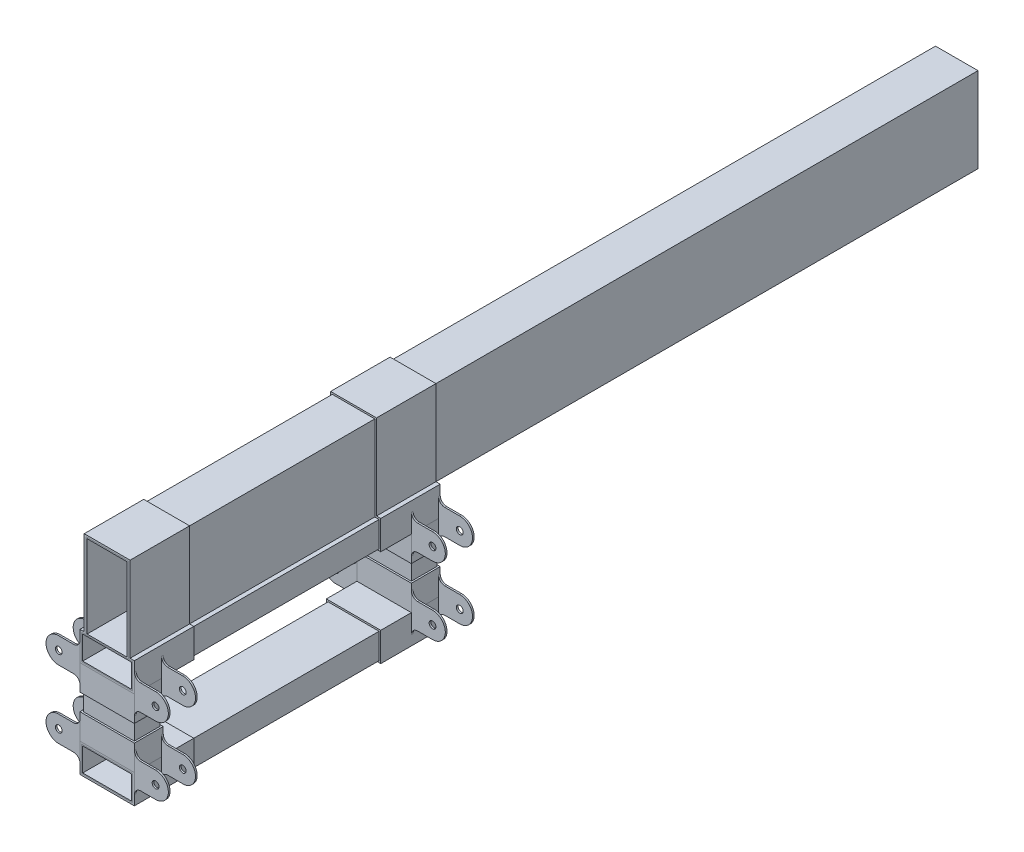
from build123d import *

# Parameters (mm, degrees)
CROQUIS1_W               = 50
CROQUIS1_H               = 100
CROQUIS1_W_2             = 47.2
CROQUIS1_H_2             = 97.2
SALIENTE_EXTRUIR1_DEPTH  = 500
CROQUIS2_W               = 60
CROQUIS2_H               = 360
SALIENTE_EXTRUIR2_DEPTH  = 30
CROQUIS3_W               = 57.6
CROQUIS3_H               = 27.6
CORTAR_EXTRUIR1_DEPTH    = 360
SALIENTE_EXTRUIR3_DEPTH  = 70
CROQUIS7_W               = 60
CROQUIS7_H               = 30
CROQUIS7_W_2             = 57.6
CROQUIS7_H_2             = 27.6
SALIENTE_EXTRUIR5_DEPTH  = 80
CROQUIS8_W               = 64
CROQUIS8_H               = 34
CROQUIS8_W_2             = 60
CROQUIS8_H_2             = 30
SALIENTE_EXTRUIR6_DEPTH  = 30
CROQUIS9_W               = 60
CROQUIS9_H               = 30
CROQUIS9_W_2             = 57.6
CROQUIS9_H_2             = 27.6
SALIENTE_EXTRUIR7_DEPTH  = 360
CROQUIS10_W              = 64
CROQUIS10_H              = 34
CROQUIS10_W_2            = 60
CROQUIS10_H_2            = 30
SALIENTE_EXTRUIR8_DEPTH  = 70
CROQUIS11_R              = 4
SALIENTE_EXTRUIR9_DEPTH  = 2
SALIENTE_EXTRUIR10_DEPTH = 2
CROQUIS13_R              = 4
SALIENTE_EXTRUIR11_DEPTH = 2
SALIENTE_EXTRUIR12_DEPTH = 2


with BuildPart() as part:
    # Croquis1 → Saliente-Extruir1 (new, symmetric)
    with BuildSketch(Plane.XY):
        Rectangle(CROQUIS1_W, CROQUIS1_H)
        Rectangle(CROQUIS1_W_2, CROQUIS1_H_2, mode=Mode.SUBTRACT)
    extrude(amount=SALIENTE_EXTRUIR1_DEPTH, both=True)


with BuildPart() as body_2:
    # Croquis2 → Saliente-Extruir2 (new body)
    with BuildSketch(Plane.XZ.offset(50)):
        with Locations((0, 320)):
            Rectangle(CROQUIS2_W, CROQUIS2_H)
    extrude(amount=SALIENTE_EXTRUIR2_DEPTH)

    # Croquis3 → Cortar-Extruir1 (cut)
    with BuildSketch(Plane.XY.offset(500)):
        with Locations((0, -65)):
            Rectangle(CROQUIS3_W, CROQUIS3_H)
    extrude(amount=-CORTAR_EXTRUIR1_DEPTH, mode=Mode.SUBTRACT)


with BuildPart() as body_3:
    # Croquis4 → Saliente-Extruir3 (new body)
    with BuildSketch(Plane.XY.offset(500)):
        Polygon((27, 52), (-27, 52), (-27, -48), (-32, -48), (-32, -82), (32, -82), (32, -48), (27, -48), align=None)
        Polygon((30, -80), (-30, -80), (-30, -50), (-25, -50), (-25, 50), (25, 50), (25, -50), (30, -50), align=None, mode=Mode.SUBTRACT)
    extrude(amount=-SALIENTE_EXTRUIR3_DEPTH)


with BuildPart() as body_4:
    # Sólido-Mover/Copiar1: copy of body 3
    add(body_3.part.moved(Location((0, 0, -300))))


with BuildPart() as body_4_1:
    # Sólido-Mover/Copiar2: read off the stored shape, not the designer's step
    # Sólido-Mover/Copiar2: moved
    add(body_4.part.moved(Location((0, 0, 10))))


with BuildPart() as body_5:
    # Croquis7 → Saliente-Extruir5 (new body)
    with BuildSketch(Plane.XZ.offset(82)):
        with Locations((0, 483)):
            Rectangle(CROQUIS7_W, CROQUIS7_H)
        with Locations((0, 483)):
            Rectangle(CROQUIS7_W_2, CROQUIS7_H_2, mode=Mode.SUBTRACT)
    extrude(amount=SALIENTE_EXTRUIR5_DEPTH)


with BuildPart() as body_6:
    # Croquis8 → Saliente-Extruir6 (new body)
    with BuildSketch(Plane.XZ.offset(82)):
        with Locations((0, 483)):
            Rectangle(CROQUIS8_W, CROQUIS8_H)
        with Locations((0, 483)):
            Rectangle(CROQUIS8_W_2, CROQUIS8_H_2, mode=Mode.SUBTRACT)
    extrude(amount=SALIENTE_EXTRUIR6_DEPTH)


with BuildPart() as body_7:
    # Sólido-Mover/Copiar4: read off the stored shape, not the designer's step
    # Sólido-Mover/Copiar4: copy of body 5
    add(body_5.part.moved(Location((0, 0, -326))))


with BuildPart() as body_8:
    # S_lido-Mover_Copiar4 2: copy of body 6
    add(body_6.part.moved(Location((0, 0, -326))))


with BuildPart() as body_9:
    # Sólido-Mover/Copiar6: read off the stored shape, not the designer's step
    # Sólido-Mover/Copiar6: copy of body 8
    add(body_8.part.moved(Location((0, -50, 0))))


with BuildPart() as body_10:
    # S_lido-Mover_Copiar6 2: copy of body 8
    add(body_8.part.moved(Location((0, -50, 326))))


with BuildPart() as body_11:
    # Croquis9 → Saliente-Extruir7 (new body)
    with BuildSketch(Plane.XY.offset(500)):
        with Locations((0, -179)):
            Rectangle(CROQUIS9_W, CROQUIS9_H)
        with Locations((0, -179)):
            Rectangle(CROQUIS9_W_2, CROQUIS9_H_2, mode=Mode.SUBTRACT)
    extrude(amount=-SALIENTE_EXTRUIR7_DEPTH)


with BuildPart() as body_12:
    # Croquis10 → Saliente-Extruir8 (new body)
    with BuildSketch(Plane.XY.offset(500)):
        with Locations((0, -179)):
            Rectangle(CROQUIS10_W, CROQUIS10_H)
        with Locations((0, -179)):
            Rectangle(CROQUIS10_W_2, CROQUIS10_H_2, mode=Mode.SUBTRACT)
    extrude(amount=-SALIENTE_EXTRUIR8_DEPTH)


with BuildPart() as body_13:
    # Sólido-Mover/Copiar8: copy of body 12
    add(body_12.part.moved(Location((0, 0, -290))))


with BuildPart() as body_14:
    # Croquis11 → Saliente-Extruir9 (new body)
    with BuildSketch(Plane.XY.offset(500)):
        with BuildLine():
            Line((32, -67), (57, -67))
            ThreePointArc((57, -67), (72, -82), (57, -97))
            Line((57, -97), (32, -97))
            Line((32, -97), (32, -67))
        make_face()
        with Locations((57, -82)):
            Circle(CROQUIS11_R, mode=Mode.SUBTRACT)
    extrude(amount=-SALIENTE_EXTRUIR9_DEPTH)

    # Croquis12 → Saliente-Extruir10 (add)
    with BuildSketch(Plane.XY.offset(500)):
        with BuildLine():
            Line((39.5, -67), (32, -67))
            Line((32, -67), (32, -59.5))
            ThreePointArc((32, -59.5), (34.196699141, -64.803300859), (39.5, -67))
        make_face()
        with BuildLine():
            Line((39.5, -97), (32, -97))
            Line((32, -97), (32, -104.5))
            ThreePointArc((32, -104.5), (34.196699141, -99.196699141), (39.5, -97))
        make_face()
    extrude(amount=-SALIENTE_EXTRUIR10_DEPTH)


with BuildPart() as body_15:
    # Sólido-Mover/Copiar10: copy of body 14
    add(body_14.part.moved(Location((0, 0, -22.134687648))))


with BuildPart() as body_15_1:
    # Sólido-Mover/Copiar11: read off the stored shape, not the designer's step
    # Sólido-Mover/Copiar11: moved
    add(body_15.part.moved(Location((0, 0, -9.8653124))))


with BuildPart() as body_16:
    # Sólido-Mover/Copiar12: read off the stored shape, not the designer's step
    # Sólido-Mover/Copiar12: copy of body 15
    add(body_15_1.part.moved(Location((0, 0, -313.3183842))))


with BuildPart() as body_17:
    # S_lido-Mover_Copiar12 2: copy of body 15
    add(body_15_1.part.moved(Location((0, 0, -281.3183842))))


with BuildPart() as body_16_1:
    # Sólido-Mover/Copiar13: read off the stored shape, not the designer's step
    # Sólido-Mover/Copiar13: moved
    add(body_16.part.moved(Location((0, 0, -12.6816158))))


with BuildPart() as body_17_1:
    # S_lido-Mover_Copiar13 2: moved
    add(body_17.part.moved(Location((0, 0, -12.6816158))))


with BuildPart() as body_18:
    # Croquis13 → Saliente-Extruir11 (new body)
    with BuildSketch(Plane.XY.offset(500)):
        with BuildLine():
            Line((32, -147), (57, -147))
            ThreePointArc((57, -147), (72, -162), (57, -177))
            Line((57, -177), (32, -177))
            Line((32, -177), (32, -147))
        make_face()
        with Locations((57, -162)):
            Circle(CROQUIS13_R, mode=Mode.SUBTRACT)
    extrude(amount=-SALIENTE_EXTRUIR11_DEPTH)

    # Croquis14 → Saliente-Extruir12 (add)
    with BuildSketch(Plane.XY.offset(500)):
        with BuildLine():
            Line((39.5, -147), (32, -147))
            Line((32, -147), (32, -139.5))
            ThreePointArc((32, -139.5), (34.196699141, -144.803300859), (39.5, -147))
        make_face()
        with BuildLine():
            Line((39.5, -177), (32, -177))
            Line((32, -177), (32, -184.5))
            ThreePointArc((32, -184.5), (34.196699141, -179.196699141), (39.5, -177))
        make_face()
    extrude(amount=-SALIENTE_EXTRUIR12_DEPTH)


with BuildPart() as body_19:
    # Sólido-Mover/Copiar14: copy of body 18
    add(body_18.part.moved(Location((0, 0, -30.003908029))))


with BuildPart() as body_19_1:
    # Sólido-Mover/Copiar15: read off the stored shape, not the designer's step
    # Sólido-Mover/Copiar15: moved
    add(body_19.part.moved(Location((0, 0, -1.996092))))


with BuildPart() as body_20:
    # Sólido-Mover/Copiar17: read off the stored shape, not the designer's step
    # Sólido-Mover/Copiar17: copy of body 19
    add(body_19_1.part.moved(Location((0, 0, -308.9967166))))


with BuildPart() as body_21:
    # S_lido-Mover_Copiar17 2: copy of body 19
    add(body_19_1.part.moved(Location((0, 0, -276.9967166))))


with BuildPart() as body_20_1:
    # Sólido-Mover/Copiar18: read off the stored shape, not the designer's step
    # Sólido-Mover/Copiar18: moved
    add(body_20.part.moved(Location((0, 0, -17.0032834))))


with BuildPart() as body_21_1:
    # S_lido-Mover_Copiar18 2: moved
    add(body_21.part.moved(Location((0, 0, -17.0032834))))


with BuildPart() as body_22:
    # Simetría1: mirrored copy
    add(body_20_1.part.mirror(Plane(origin=(0, 0, 0), x_dir=(0, 0, 1), z_dir=(1, 0, 0))))


with BuildPart() as body_23:
    # Simetr_a1 2: mirrored copy
    add(body_21_1.part.mirror(Plane(origin=(0, 0, 0), x_dir=(0, 0, 1), z_dir=(1, 0, 0))))


with BuildPart() as body_24:
    # Simetr_a1 3: mirrored copy
    add(body_19_1.part.mirror(Plane(origin=(0, 0, 0), x_dir=(0, 0, 1), z_dir=(1, 0, 0))))


with BuildPart() as body_25:
    # Simetr_a1 4: mirrored copy
    add(body_18.part.mirror(Plane(origin=(0, 0, 0), x_dir=(0, 0, 1), z_dir=(1, 0, 0))))


with BuildPart() as body_26:
    # Simetr_a1 5: mirrored copy
    add(body_17_1.part.mirror(Plane(origin=(0, 0, 0), x_dir=(0, 0, 1), z_dir=(1, 0, 0))))


with BuildPart() as body_27:
    # Simetr_a1 6: mirrored copy
    add(body_16_1.part.mirror(Plane(origin=(0, 0, 0), x_dir=(0, 0, 1), z_dir=(1, 0, 0))))


with BuildPart() as body_28:
    # Simetr_a1 7: mirrored copy
    add(body_15_1.part.mirror(Plane(origin=(0, 0, 0), x_dir=(0, 0, 1), z_dir=(1, 0, 0))))


with BuildPart() as body_29:
    # Simetr_a1 8: mirrored copy
    add(body_14.part.mirror(Plane(origin=(0, 0, 0), x_dir=(0, 0, 1), z_dir=(1, 0, 0))))


solid = Compound([part.part, body_2.part, body_3.part, body_4_1.part, body_5.part, body_6.part, body_7.part, body_8.part, body_9.part, body_10.part, body_11.part, body_12.part, body_13.part, body_14.part, body_15_1.part, body_16_1.part, body_17_1.part, body_18.part, body_19_1.part, body_20_1.part, body_21_1.part, body_22.part, body_23.part, body_24.part, body_25.part, body_26.part, body_27.part, body_28.part, body_29.part])
